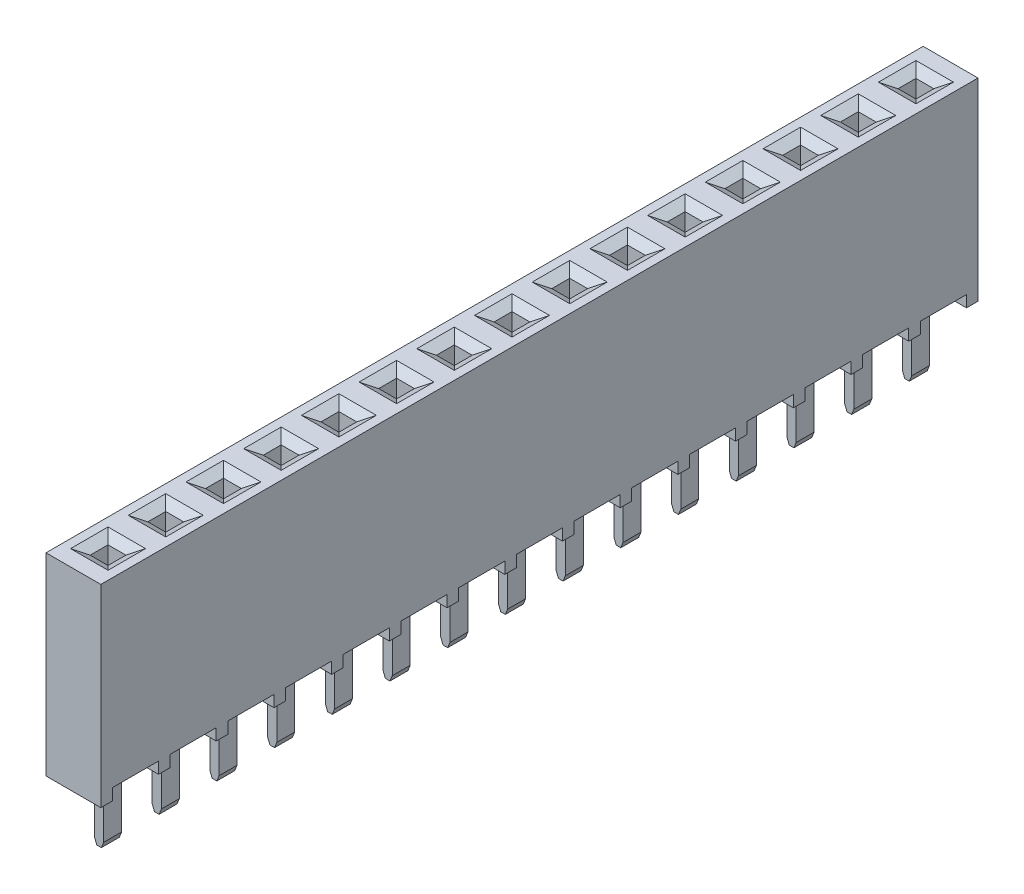
from build123d import *

# Parameters (mm, degrees)
SKETCH1_W                   = 2.413
SKETCH1_H                   = 38.608
MAIN_BODY_DEPTH             = 8.509
CUT_EXTRUDE2_REACH          = 23.234
SKETCH5_W                   = 2.032
SKETCH5_H                   = 0.508
LPATTERN1_COUNT             = 15
LPATTERN1_PITCH             = 2.54
SKETCH2_W                   = 0.7874
SKETCH2_H                   = 0.7874
CUT_EXTRUDE1_DEPTH          = 22.130620891
CHAMFER1_SIZE               = 0.4318
CHAMFER1_SIZE2              = 0.249299846
LPATTERN2_COUNT             = 15
LPATTERN2_PITCH             = 2.54
CHAMFER1_OF_LPATTERN2_SIZE2 = 0.249299846
CHAMFER1_OF_LPATTERN2_SIZE  = 0.4318
PIN_DEPTH                   = 0.3937
LPATTERN4_COUNT             = 15
LPATTERN4_PITCH             = 2.54


with BuildPart() as part:
    # Sketch1 → Main Body (new body)
    with BuildSketch(Plane(origin=(0, 0, 0), x_dir=(1, 0, 0), z_dir=(0, 1, 0))):
        Rectangle(SKETCH1_W, SKETCH1_H)
    extrude(amount=MAIN_BODY_DEPTH)

    # Sketch5 → Cut-Extrude2 (cut, up to next)
    with BuildSketch(Plane(origin=(1.2065, 0, 0), x_dir=(0, 0, -1), z_dir=(1, 0, 0)), mode=Mode.PRIVATE) as cut_extrude2_sk1:
        with Locations((17.78, 0.254)):
            Rectangle(SKETCH5_W, SKETCH5_H)
    cut_extrude2_tool1 = extrude(cut_extrude2_sk1.sketch, amount=-CUT_EXTRUDE2_REACH, mode=Mode.PRIVATE) & part.part
    cut_extrude2 = cut_extrude2_tool1.solids().sort_by_distance((1.2065, 0.254, -17.78))[0]
    add(cut_extrude2, mode=Mode.SUBTRACT)

    # LPattern1: Cut-Extrude2 ×15
    with Locations(*[(0, 0, i * LPATTERN1_PITCH) for i in range(1, LPATTERN1_COUNT)]):
        add(cut_extrude2, mode=Mode.SUBTRACT)

    # Sketch2 → Cut-Extrude1 (cut, through all)
    with BuildSketch(Plane(origin=(0, 8.509, 0), x_dir=(-1, 0, 0), z_dir=(0, 1, 0))):
        with Locations((0, -17.78)):
            Rectangle(SKETCH2_W, SKETCH2_H)
    cut_extrude1 = extrude(amount=-CUT_EXTRUDE1_DEPTH, mode=Mode.SUBTRACT)

    # Chamfer1
    chamfer1_edges = [part.edges().sort_by_distance(p)[0] for p in [
        (0, 8.509, -18.1737),
        (-0.3937, 8.509, -17.78),
        (0, 8.509, -17.3863),
        (0.3937, 8.509, -17.78),
    ]]
    chamfer1_side = [part.faces().sort_by_distance(p)[0] for p in [
        (0, 8.509, 0.119120881),
    ]]
    chamfer(chamfer1_edges, length=CHAMFER1_SIZE, length2=CHAMFER1_SIZE2, reference=chamfer1_side[0])

    # LPattern2: Cut-Extrude1 ×15
    with Locations(*[(0, 0, i * LPATTERN2_PITCH) for i in range(1, LPATTERN2_COUNT)]):
        add(cut_extrude1, mode=Mode.SUBTRACT)

    # Chamfer1 of LPattern2
    chamfer1_of_lpattern2_edges = [part.edges().sort_by_distance(p)[0] for p in [
        (0, 8.509, -15.6337),
        (-0.3937, 8.509, -15.24),
        (0, 8.509, -14.8463),
        (0.3937, 8.509, -15.24),
        (0, 8.509, -13.0937),
        (-0.3937, 8.509, -12.7),
        (0, 8.509, -12.3063),
        (0.3937, 8.509, -12.7),
        (0, 8.509, -10.5537),
        (-0.3937, 8.509, -10.16),
        (0, 8.509, -9.7663),
        (0.3937, 8.509, -10.16),
        (0, 8.509, -8.0137),
        (-0.3937, 8.509, -7.62),
        (0, 8.509, -7.2263),
        (0.3937, 8.509, -7.62),
        (0, 8.509, -5.4737),
        (-0.3937, 8.509, -5.08),
        (0, 8.509, -4.6863),
        (0.3937, 8.509, -5.08),
        (0, 8.509, -2.9337),
        (-0.3937, 8.509, -2.54),
        (0, 8.509, -2.1463),
        (0.3937, 8.509, -2.54),
        (0, 8.509, -0.3937),
        (-0.3937, 8.509, 0),
        (0, 8.509, 0.3937),
        (0.3937, 8.509, 0),
        (0, 8.509, 2.1463),
        (-0.3937, 8.509, 2.54),
        (0, 8.509, 2.9337),
        (0.3937, 8.509, 2.54),
        (0, 8.509, 4.6863),
        (-0.3937, 8.509, 5.08),
        (0, 8.509, 5.4737),
        (0.3937, 8.509, 5.08),
        (0, 8.509, 7.2263),
        (-0.3937, 8.509, 7.62),
        (0, 8.509, 8.0137),
        (0.3937, 8.509, 7.62),
        (0, 8.509, 9.7663),
        (-0.3937, 8.509, 10.16),
        (0, 8.509, 10.5537),
        (0.3937, 8.509, 10.16),
        (0, 8.509, 12.3063),
        (-0.3937, 8.509, 12.7),
        (0, 8.509, 13.0937),
        (0.3937, 8.509, 12.7),
        (0, 8.509, 14.8463),
        (-0.3937, 8.509, 15.24),
        (0, 8.509, 15.6337),
        (0.3937, 8.509, 15.24),
        (0, 8.509, 17.3863),
        (-0.3937, 8.509, 17.78),
        (0, 8.509, 18.1737),
        (0.3937, 8.509, 17.78),
    ]]
    chamfer(chamfer1_of_lpattern2_edges, length=CHAMFER1_OF_LPATTERN2_SIZE, length2=CHAMFER1_OF_LPATTERN2_SIZE2)

    # Sketch4 → PIN (add, symmetric)
    with BuildSketch(Plane(origin=(0, 0, -17.78), x_dir=(-1, 0, 0), z_dir=(0, 0, -1))):
        Polygon((-0.3937, 1.016), (0.3937, 1.016), (0.3937, 0.889), (0.2032, 0.889), (0.2032, -2.3876), (0.1016, -2.6416), (-0.1016, -2.6416), (-0.2032, -2.3876), (-0.2032, 0.889), (-0.3937, 0.889), align=None)
    pin = extrude(amount=PIN_DEPTH, both=True)

    # LPattern4: PIN ×15
    with Locations(*[(0, 0, i * LPATTERN4_PITCH) for i in range(1, LPATTERN4_COUNT)]):
        add(pin)


solid = part.part
